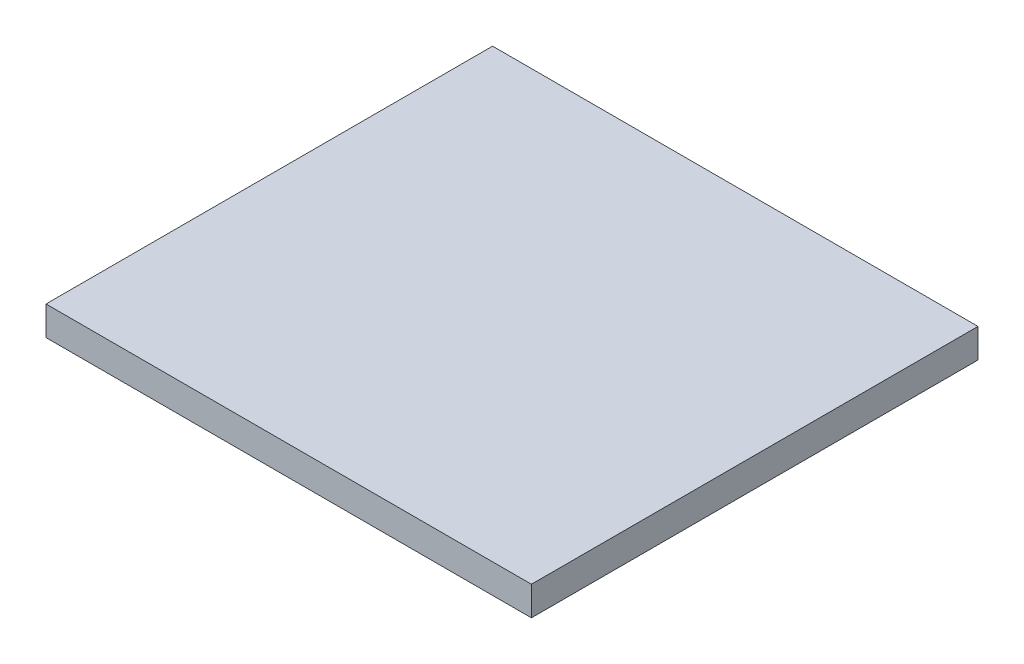
from build123d import *

# Parameters (mm, degrees)
SKETCH1_W           = 100
SKETCH1_H           = 92
BOSS_EXTRUDE1_DEPTH = 6


with BuildPart() as part:
    # Sketch1 → Boss-Extrude1 (new body)
    with BuildSketch(Plane(origin=(0, 0, 0), x_dir=(1, 0, 0), z_dir=(0, 1, 0))):
        with Locations((50, 46)):
            Rectangle(SKETCH1_W, SKETCH1_H)
    extrude(amount=BOSS_EXTRUDE1_DEPTH)


solid = part.part
